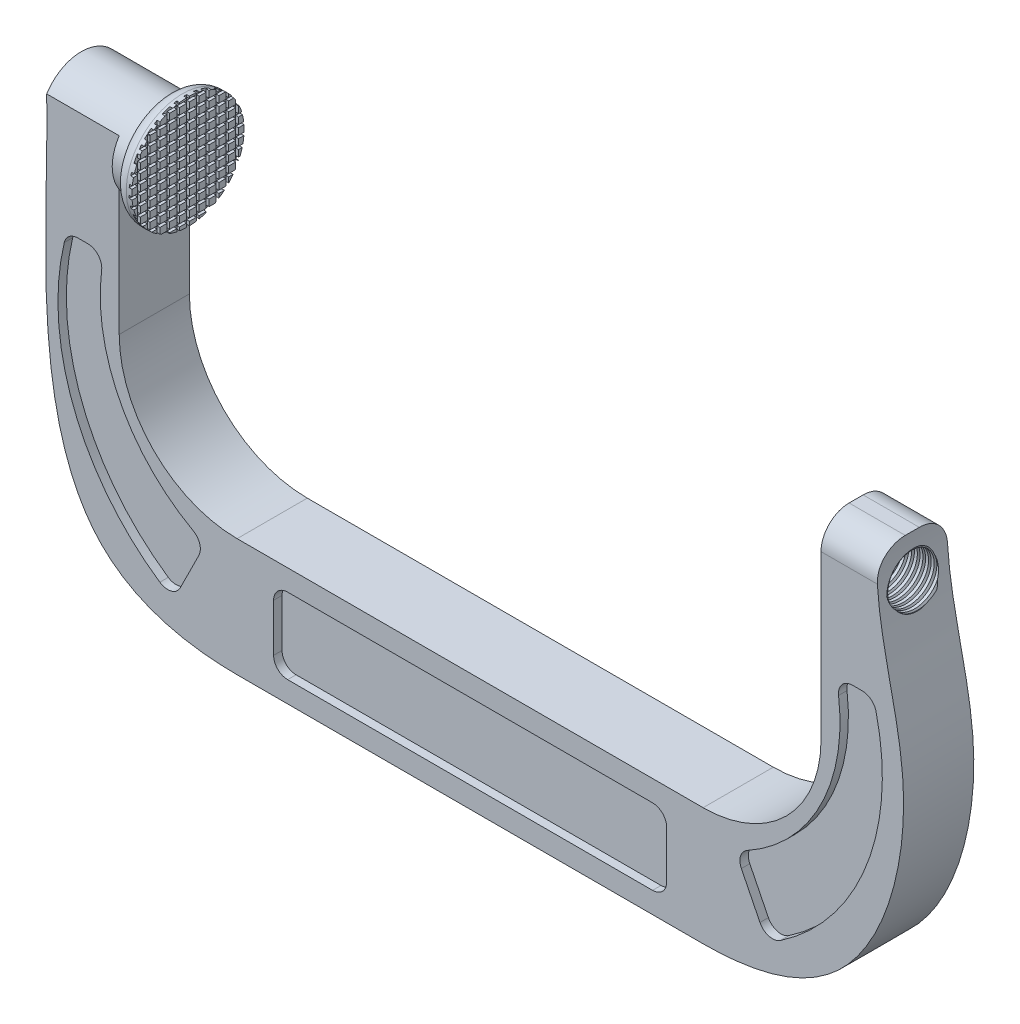
from build123d import *

# Parameters (mm, degrees)
BOSS_EXTRUDE1_DEPTH  = 12.5
SKETCH2_R            = 15
BOSS_EXTRUDE2_DEPTH  = 5
CUT_EXTRUDE1_DEPTH   = 319.437212385
SKETCH4_R            = 20
BOSS_EXTRUDE3_DEPTH  = 7
FILLET1_R            = 5
SKETCH5_R            = 8.78
CUT_EXTRUDE2_DEPTH   = 316.721396306
CUT_SWEEP1_PITCH     = 2
FILLET2_R            = 10
SKETCH8_W            = 140
SKETCH8_H            = 27
CUT_EXTRUDE3_DEPTH   = 3
FILLET3_R            = 5
FILLET3_OF_MIRROR2_R = 5
SKETCH9_W            = 45
SKETCH9_H            = 1
CUT_EXTRUDE4_DEPTH   = 1
SKETCH10_W           = 1
SKETCH10_H           = 80
CUT_EXTRUDE5_DEPTH   = 1


with BuildPart() as part:
    # Sketch1 → Boss-Extrude1 (new, symmetric)
    with BuildSketch(Plane.XY):
        with BuildLine():
            Line((145, 0), (125, 0))
            Line((125, 0), (125, -68))
            ThreePointArc((125, -68), (112.69848481, -97.69848481), (83, -110))
            Line((83, -110), (-83, -110))
            ThreePointArc((-83, -110), (-112.69848481, -97.69848481), (-125, -68))
            Line((-125, -68), (-125, 0))
            Line((-125, 0), (-151, 0))
            add(Edge.make_bspline(
                [(-151, 0), (-150.590436993, -11.809548171), (-150.795218497, -22.904774085), (-151, -34)],
                knots=[0, 0, 0, 0, 0.179256074, 0.179256074, 0.179256074, 0.179256074], degree=3))
            Line((-151, -34), (-151, -68))
            add(Edge.make_bspline(
                [(-151, -68), (-150.165022419, -92.076168512), (-144.217264958, -139.549454559), (-104.555287795, -151.959449734), (-83, -152)],
                knots=[0.358512149, 0.358512149, 0.358512149, 0.358512149, 0.723962155, 1, 1, 1, 1], degree=3))
            Line((-83, -152), (83, -152))
            add(Edge.make_bspline(
                [(145, 0), (143.808727894, -23.91518007), (162.647824727, -65.626077064), (142.698991088, -139.19242164), (104.375372349, -151.959788195), (83, -152)],
                knots=[0, 0, 0, 0, 0.358889212, 0.726266159, 1, 1, 1, 1], degree=3))
        make_face()
    extrude(amount=BOSS_EXTRUDE1_DEPTH, both=True)

    # Sketch2 → Boss-Extrude2 (add)
    with BuildSketch(Plane(origin=(-125, 0, 0), x_dir=(0, 0, -1), z_dir=(1, 0, 0))):
        with Locations(Location((0, -15, 0), (0, 0, 146.442690238))):
            Circle(SKETCH2_R)
    extrude(amount=BOSS_EXTRUDE2_DEPTH)

    # Sketch3 → Cut-Extrude1 (cut, through all)
    with BuildSketch(Plane(origin=(-125, 0, 0), x_dir=(0, 0, -1), z_dir=(1, 0, 0))):
        with BuildLine():
            ThreePointArc((-12.5, -6.708438024), (-7.093185827, -1.783089816), (0, 0))
            Line((0, 0), (-12.5, 0))
            Line((-12.5, 0), (-12.5, -6.708438024))
        make_face()
        with BuildLine():
            Line((12.5, 0), (0, 0))
            ThreePointArc((0, 0), (7.093185827, -1.783089816), (12.5, -6.708438024))
            Line((12.5, -6.708438024), (12.5, 0))
        make_face()
    extrude(amount=-CUT_EXTRUDE1_DEPTH, mode=Mode.SUBTRACT)

    # Sketch4 → Boss-Extrude3 (add)
    with BuildSketch(Plane(origin=(-120, 0, 0), x_dir=(0, 0, -1), z_dir=(1, 0, 0))):
        with Locations((0, -15)):
            Circle(SKETCH4_R)
    extrude(amount=BOSS_EXTRUDE3_DEPTH)

    # Fillet1
    fillet1_edges = [part.edges().sort_by_distance(p)[0] for p in [
        (-120, -15, 20),
    ]]
    fillet(fillet1_edges, radius=FILLET1_R - 0.0001)  # a hair under: the kernel refuses the full size

    # Sketch5 → Cut-Extrude2 (cut, through all)
    with BuildSketch(Plane.ZY.offset(-125)):
        with Locations((0, -15)):
            Circle(SKETCH5_R)
    extrude(amount=-CUT_EXTRUDE2_DEPTH, mode=Mode.SUBTRACT)

    # Cut-Sweep1: arcs per turn and ends read off the stored shape
    # Cut-Sweep1: the profile of Sketch7 screwed along a right-hand helix through 16 turns, 10 arcs to a turn; built about Z, then put on its axis
    cut_sweep1_z = Axis((0, 0, 0), (0, 0, 1))
    cut_sweep1_corners = [(8.373333333, 0, -1.295632672), (9.593333333, 0, -2), (8.373333333, 0, -2.704367328)]
    with BuildLine(mode=Mode.PRIVATE) as cut_sweep1_profile:
        Line(cut_sweep1_corners[0], cut_sweep1_corners[1])
        Line(cut_sweep1_corners[1], cut_sweep1_corners[2])
        Line(cut_sweep1_corners[2], cut_sweep1_corners[0])
    cut_sweep1_cap = Face(cut_sweep1_profile.wire())
    cut_sweep1_turn_angles = [0, 18, 36, 54, 72, 90, 108, 126, 144, 162, 180, 198, 216, 234, 252, 270, 288, 306, 324, 342, 360]
    cut_sweep1_turn_weights = [1, 0.9510565162951535, 1, 0.9510565162951535, 1, 0.9510565162951535, 1, 0.9510565162951535, 1, 0.9510565162951535, 1, 0.9510565162951535, 1, 0.9510565162951535, 1, 0.9510565162951535, 1, 0.9510565162951535, 1, 0.9510565162951535, 1]
    cut_sweep1_turn_rails = [Edge.make_bspline([Vector(p[0], p[1], 0).rotate(cut_sweep1_z, cut_sweep1_turn_angles[k]) / cut_sweep1_turn_weights[k] + Vector(0, 0, p[2] + CUT_SWEEP1_PITCH * cut_sweep1_turn_angles[k] / 360) for k in range(21)], [0, 0, 0, 1, 1, 2, 2, 3, 3, 4, 4, 5, 5, 6, 6, 7, 7, 8, 8, 9, 9, 10, 10, 10], 2, cut_sweep1_turn_weights) for p in cut_sweep1_corners]
    cut_sweep1_turn_sides = [Face.make_surface_from_curves(cut_sweep1_turn_rails[p[0]], cut_sweep1_turn_rails[p[1]]) for p in [(0, 1), (1, 2), (2, 0)]]
    cut_sweep1 = Plane(origin=(125, -15, 0), x_dir=(0, 1, 0), z_dir=(1, 0, 0)) * Solid(Shell([*[p.moved(Location((0, 0, CUT_SWEEP1_PITCH * i))) for i in range(16) for p in cut_sweep1_turn_sides], cut_sweep1_cap, cut_sweep1_cap.rotate(cut_sweep1_z, 5760).moved(Location((0, 0, CUT_SWEEP1_PITCH * 5760 / 360)))]))
    add(cut_sweep1, mode=Mode.SUBTRACT)

    # Fillet2
    fillet2_edges = [part.edges().sort_by_distance(p)[0] for p in [
        (135, 0, -12.5),
        (135, 0, 12.5),
    ]]
    fillet(fillet2_edges, radius=FILLET2_R)

    # Sketch8 → Cut-Extrude3 (cut)
    with BuildSketch(Plane.XY.offset(12.5)):
        with Locations((0, -131)):
            Rectangle(SKETCH8_W, SKETCH8_H)
        with BuildLine():
            Line((130.276272134, -45.611950938), (143.557896926, -45.611950938))
            ThreePointArc((143.557896926, -45.611950938), (140.908666677, -99.438573292), (105.705266268, -140.243527583))
            Line((105.705266268, -140.243527583), (94.415885195, -117.5))
            ThreePointArc((94.415885195, -117.5), (125.037374801, -87.886857947), (130.276272134, -45.611950938))
        make_face()
        with BuildLine():
            Line((-94.415885195, -117.5), (-105.705266268, -140.243527583))
            ThreePointArc((-105.705266268, -140.243527583), (-140.908666677, -99.438573292), (-143.557896926, -45.611950938))
            Line((-143.557896926, -45.611950938), (-130.276272134, -45.611950938))
            ThreePointArc((-130.276272134, -45.611950938), (-125.037374801, -87.886857947), (-94.415885195, -117.5))
        make_face()
    cut_extrude3 = extrude(amount=-CUT_EXTRUDE3_DEPTH, mode=Mode.SUBTRACT)

    # Fillet3
    fillet3_edges = [part.edges().sort_by_distance(p)[0] for p in [
        (-105.705266268, -140.243527583, 11),
        (-143.557896926, -45.611950938, 11),
        (-130.276272134, -45.611950938, 11),
        (-94.415885195, -117.5, 11),
        (94.415885195, -117.5, 11),
        (130.276272134, -45.611950938, 11),
        (143.557896926, -45.611950938, 11),
        (105.705266268, -140.243527583, 11),
        (70, -117.5, 11),
        (70, -144.5, 11),
        (-70, -144.5, 11),
        (-70, -117.5, 11),
    ]]
    fillet(fillet3_edges, radius=FILLET3_R)

    # Mirror2: Cut-Extrude3 across plane
    add(cut_extrude3.mirror(Plane.XY), mode=Mode.SUBTRACT)

    # Fillet3 of Mirror2
    fillet3_of_mirror2_edges = [part.edges().sort_by_distance(p)[0] for p in [
        (-105.705266268, -140.243527583, -11),
        (-143.557896926, -45.611950938, -11),
        (-130.276272134, -45.611950938, -11),
        (-94.415885195, -117.5, -11),
        (94.415885195, -117.5, -11),
        (130.276272134, -45.611950938, -11),
        (143.557896926, -45.611950938, -11),
        (105.705266268, -140.243527583, -11),
        (70, -117.5, -11),
        (70, -144.5, -11),
        (-70, -144.5, -11),
        (-70, -117.5, -11),
    ]]
    fillet(fillet3_of_mirror2_edges, radius=FILLET3_OF_MIRROR2_R)

    # Sketch9 → Cut-Extrude4 (cut)
    with BuildSketch(Plane(origin=(-113, 0, 0), x_dir=(0, 0, -1), z_dir=(1, 0, 0))):
        with Locations((0, 0.4)):
            Rectangle(SKETCH9_W, SKETCH9_H)
        with Locations((0, 3.75)):
            Rectangle(SKETCH9_W, SKETCH9_H)
        with Locations((0, -2.95)):
            Rectangle(SKETCH9_W, SKETCH9_H)
        with Locations((0, -6.3)):
            Rectangle(SKETCH9_W, SKETCH9_H)
        with Locations((0, -9.65)):
            Rectangle(SKETCH9_W, SKETCH9_H)
        with Locations((0, -13)):
            Rectangle(SKETCH9_W, SKETCH9_H)
        with Locations((0, -16.35)):
            Rectangle(SKETCH9_W, SKETCH9_H)
        with Locations((0, -19.7)):
            Rectangle(SKETCH9_W, SKETCH9_H)
        with Locations((0, -23.05)):
            Rectangle(SKETCH9_W, SKETCH9_H)
        with Locations((0, -26.4)):
            Rectangle(SKETCH9_W, SKETCH9_H)
        with Locations((0, -29.75)):
            Rectangle(SKETCH9_W, SKETCH9_H)
        with Locations((0, -33.1)):
            Rectangle(SKETCH9_W, SKETCH9_H)
    extrude(amount=-CUT_EXTRUDE4_DEPTH, mode=Mode.SUBTRACT)

    # Sketch10 → Cut-Extrude5 (cut)
    with BuildSketch(Plane(origin=(-113, 0, 0), x_dir=(0, 0, -1), z_dir=(1, 0, 0))):
        with Locations((3.5, 0)):
            Rectangle(SKETCH10_W, SKETCH10_H)
        Rectangle(SKETCH10_W, SKETCH10_H)
        with Locations((7, 0)):
            Rectangle(SKETCH10_W, SKETCH10_H)
        with Locations((10.5, 0)):
            Rectangle(SKETCH10_W, SKETCH10_H)
        with Locations((14, 0)):
            Rectangle(SKETCH10_W, SKETCH10_H)
        with Locations((17.5, 0)):
            Rectangle(SKETCH10_W, SKETCH10_H)
        with Locations((-17.5, 0)):
            Rectangle(SKETCH10_W, SKETCH10_H)
        with Locations((-14, 0)):
            Rectangle(SKETCH10_W, SKETCH10_H)
        with Locations((-10.5, 0)):
            Rectangle(SKETCH10_W, SKETCH10_H)
        with Locations((-7, 0)):
            Rectangle(SKETCH10_W, SKETCH10_H)
        with Locations((-3.5, 0)):
            Rectangle(SKETCH10_W, SKETCH10_H)
    extrude(amount=-CUT_EXTRUDE5_DEPTH, mode=Mode.SUBTRACT)


solid = part.part
